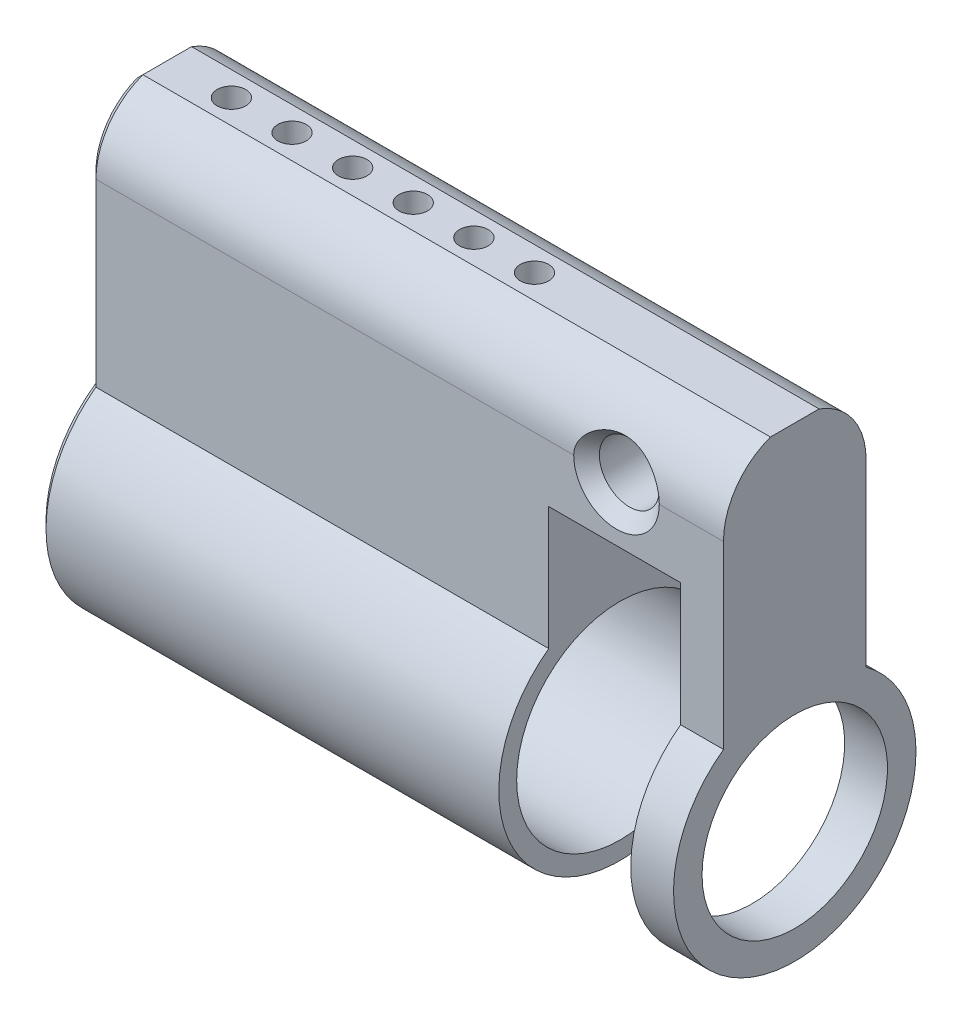
from build123d import *

# Parameters (mm, degrees)
EURO_CYLINDER_OUTLINE_DEPTH = 44.5
SKETCH9_R                   = 7.25
BORE_FOR_CORE_DEPTH         = 37
SKETCH2_R                   = 1
HOLE_FOR_PIN_DEPTH          = 35
LPATTERN_OF_6_COUNT         = 6
LPATTERN_OF_6_PITCH         = 4.25
OPENNING_DEPTH              = 53.422705051
OPENNING_DEPTH_BACK         = 53.422705051
SKETCH3_W                   = 9.25
SKETCH3_H                   = 24
F_0_5_X_45_DEG_SIZE         = 0.5
SKETCH10_R                  = 6.5
DIA_13_END_BIT_DEPTH        = 49.786678644


with BuildPart() as part:
    # Sketch1 → euro cylinder outline (new body)
    with BuildSketch(Plane(origin=(0, 0, 0), x_dir=(0, 0, -1), z_dir=(1, 0, 0))):
        with BuildLine():
            Line((-5, 19.5), (-5, 6.873863542))
            ThreePointArc((-5, 6.873863542), (0, -8.5), (5, 6.873863542))
            Line((5, 6.873863542), (5, 19.5))
            ThreePointArc((5, 19.5), (4.094469505, 22.369724634), (1.705872211, 24.2))
            Line((1.705872211, 24.2), (-1.705872211, 24.2))
            ThreePointArc((-1.705872211, 24.2), (-4.094469505, 22.369724634), (-5, 19.5))
        make_face()
    extrude(amount=EURO_CYLINDER_OUTLINE_DEPTH)

    # Sketch9 → bore for core (cut)
    with BuildSketch(Plane.ZY):
        Circle(SKETCH9_R)
    extrude(amount=-BORE_FOR_CORE_DEPTH, mode=Mode.SUBTRACT)

    # Sketch2 → hole for pin (cut)
    with BuildSketch(Plane(origin=(0, 0, 0), x_dir=(1, 0, 0), z_dir=(0, 1, 0))):
        with Locations(Location((5, 0, 0), (0, 0, 90))):
            Circle(SKETCH2_R)
    hole_for_pin = extrude(amount=HOLE_FOR_PIN_DEPTH, mode=Mode.SUBTRACT)

    # LPattern of 6: hole for pin ×6
    with Locations(*[(i * LPATTERN_OF_6_PITCH, 0, 0) for i in range(1, LPATTERN_OF_6_COUNT)]):
        add(hole_for_pin, mode=Mode.SUBTRACT)

    # Sketch3 → openning (cut, two sides: drawn at the far end of the back side and taken through both)
    with BuildSketch(Plane.XY.offset(5).offset(-OPENNING_DEPTH_BACK)):
        with Locations((36.875, 3.5)):
            Rectangle(SKETCH3_W, SKETCH3_H)
    extrude(amount=OPENNING_DEPTH + OPENNING_DEPTH_BACK, mode=Mode.SUBTRACT)

    # Sketch7 → M5x0.8 mounting hole (revolve, cut)
    with BuildSketch(Plane(origin=(37, 19.5, 5), x_dir=(0, -1, 0), z_dir=(1, 0, 0))):
        Polygon((0, 0), (0, 10), (3, 10), (2.1, 9.1), (2.1, 0.9), (3, 0), align=None)
    revolve(axis=Axis((37, 19.5, 11.35), (0, 0, -1)), mode=Mode.SUBTRACT)

    # 0.5 x 45 deg
    f_0_5_x_45_deg_edges = [part.edges().sort_by_distance(p)[0] for p in [
        (0, 24.2, 0),
    ]]
    chamfer(f_0_5_x_45_deg_edges, length=F_0_5_X_45_DEG_SIZE)
    f_0_5_x_45_deg_2_edges = [part.edges().sort_by_distance(p)[0] for p in [
        (0, 21.891164992, -4.391164992),
        (0, 13.186931771, -5),
    ]]
    chamfer(f_0_5_x_45_deg_2_edges, length=F_0_5_X_45_DEG_SIZE)
    f_0_5_x_45_deg_3_edges = [part.edges().sort_by_distance(p)[0] for p in [
        (0, 21.891164992, 4.391164992),
        (0, 13.186931771, 5),
    ]]
    chamfer(f_0_5_x_45_deg_3_edges, length=F_0_5_X_45_DEG_SIZE)
    f_0_5_x_45_deg_4_edges = [part.edges().sort_by_distance(p)[0] for p in [
        (0, -8.5, 0),
    ]]
    chamfer(f_0_5_x_45_deg_4_edges, length=F_0_5_X_45_DEG_SIZE - 0.0001)  # a hair under: the kernel refuses the full size

    # Sketch10 → dia 13 end bit (cut, through all)
    with BuildSketch(Plane.ZY.offset(-41.5)):
        Circle(SKETCH10_R)
    extrude(amount=-DIA_13_END_BIT_DEPTH, mode=Mode.SUBTRACT)


solid = part.part
